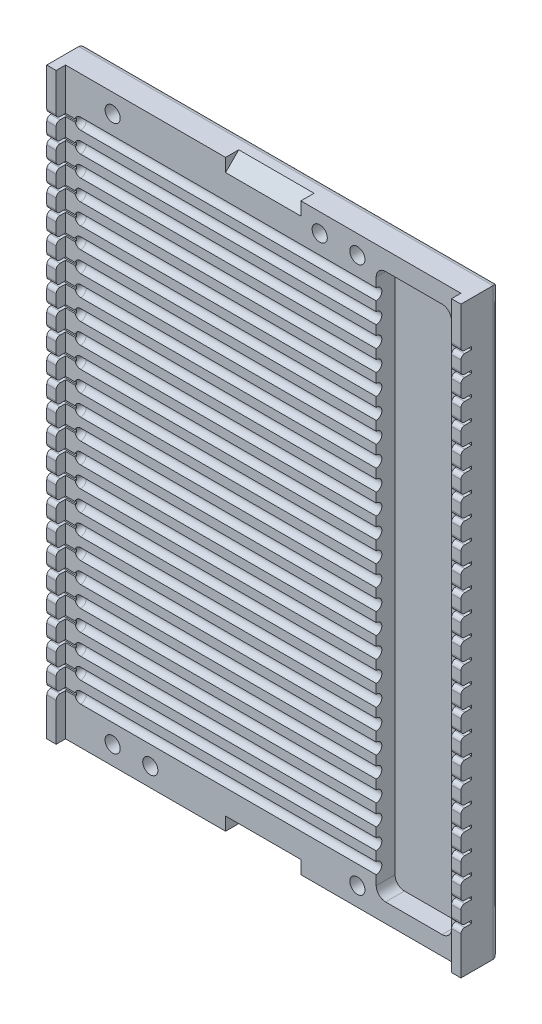
from build123d import *

# Parameters (mm, degrees)
SKETCH_1_W             = 220
SKETCH_1_H             = 310
EXTRUDE_1_DEPTH        = 15
SKETCH_8_W             = 5
SKETCH_8_H             = 310
EXTRUDE_2_DEPTH        = 5
PATTERN_LINEAR_1_COUNT = 25
PATTERN_LINEAR_1_PITCH = 11
SKETCH_4_W             = 40
SKETCH_4_H             = 290
CUT_EXTRUDE_2_DEPTH    = 10
CUT_EXTRUDE_3_DEPTH    = 220
SKETCH_7_R             = 4.025
CUT_EXTRUDE_4_DEPTH    = 191.656759649
FILLET_1_R             = 3
FILLET_2_R             = 5
SKETCH_9_W             = 40
SKETCH_9_H             = 7
CUT_EXTRUDE_6_DEPTH    = 7
CHAMFER_1_SIZE         = 7


# Read off the part's stored shape, not the designer's step: Вырез-Повернуть1
with BuildPart() as part:
    # Эскиз1 → Бобышка-Вытянуть1 (new body)
    with BuildSketch(Plane.XY):
        Rectangle(SKETCH_1_W, SKETCH_1_H)
    extrude(amount=EXTRUDE_1_DEPTH)

    # Эскиз8 → Бобышка-Вытянуть2 (add)
    with BuildSketch(Plane.XY.offset(15)):
        with Locations((-107.5, 0)):
            Rectangle(SKETCH_8_W, SKETCH_8_H)
        with Locations((107.5, 0)):
            Rectangle(SKETCH_8_W, SKETCH_8_H)
    extrude(amount=EXTRUDE_2_DEPTH)

    # Вырез-Повернуть1 outline → Вырез-Повернуть1 (revolve, cut)
    with BuildSketch(Plane(origin=(0, 132, 15), x_dir=(0, 1, 0), z_dir=(0, 0, -1))):
        with BuildLine():
            Line((0, 60), (0, -100))
            ThreePointArc((0, -100), (2.121320344, -99.121320344), (3, -97))
            Line((3, -97), (3, 60))
            Line((3, 60), (0, 60))
        make_face()
    cut_revolve_1 = revolve(axis=Axis((0, 132, 15), (1, 0, 0)), mode=Mode.SUBTRACT)

    # Линейный массив1: Вырез-Повернуть1 ×25
    with Locations(*[(0, -i * PATTERN_LINEAR_1_PITCH, 0) for i in range(1, PATTERN_LINEAR_1_COUNT)]):
        add(cut_revolve_1, mode=Mode.SUBTRACT)

    # Эскиз4 → Вырез-Вытянуть2 (cut)
    with BuildSketch(Plane.XY.offset(15)):
        with Locations((80, 0)):
            Rectangle(SKETCH_4_W, SKETCH_4_H)
    extrude(amount=-CUT_EXTRUDE_2_DEPTH, mode=Mode.SUBTRACT)

    # Эскиз6 → Вырез-Вытянуть3 (cut)
    with BuildSketch(Plane.ZY.offset(110)):
        with BuildLine():
            Line((18, 121.75), (14.3, 121.75))
            Line((14.3, 121.75), (14.3, 120.25))
            Line((14.3, 120.25), (18, 120.25))
            ThreePointArc((18, 120.25), (19.414213562, 119.664213562), (20, 118.25))
            Line((20, 118.25), (20, 123.75))
            ThreePointArc((20, 123.75), (19.414213562, 122.335786438), (18, 121.75))
        make_face()
        with BuildLine():
            Line((18, 132.75), (14.3, 132.75))
            Line((14.3, 132.75), (14.3, 131.25))
            Line((14.3, 131.25), (18, 131.25))
            ThreePointArc((18, 131.25), (19.414213562, 130.664213562), (20, 129.25))
            Line((20, 129.25), (20, 134.75))
            ThreePointArc((20, 134.75), (19.414213562, 133.335786438), (18, 132.75))
        make_face()
        with BuildLine():
            Line((18, 110.75), (14.3, 110.75))
            Line((14.3, 110.75), (14.3, 109.25))
            Line((14.3, 109.25), (18, 109.25))
            ThreePointArc((18, 109.25), (19.414213562, 108.664213562), (20, 107.25))
            Line((20, 107.25), (20, 112.75))
            ThreePointArc((20, 112.75), (19.414213562, 111.335786438), (18, 110.75))
        make_face()
        with BuildLine():
            Line((18, 99.75), (14.3, 99.75))
            Line((14.3, 99.75), (14.3, 98.25))
            Line((14.3, 98.25), (18, 98.25))
            ThreePointArc((18, 98.25), (19.414213562, 97.664213562), (20, 96.25))
            Line((20, 96.25), (20, 101.75))
            ThreePointArc((20, 101.75), (19.414213562, 100.335786438), (18, 99.75))
        make_face()
        with BuildLine():
            Line((18, 88.75), (14.3, 88.75))
            Line((14.3, 88.75), (14.3, 87.25))
            Line((14.3, 87.25), (18, 87.25))
            ThreePointArc((18, 87.25), (19.414213562, 86.664213562), (20, 85.25))
            Line((20, 85.25), (20, 90.75))
            ThreePointArc((20, 90.75), (19.414213562, 89.335786438), (18, 88.75))
        make_face()
        with BuildLine():
            Line((18, 77.75), (14.3, 77.75))
            Line((14.3, 77.75), (14.3, 76.25))
            Line((14.3, 76.25), (18, 76.25))
            ThreePointArc((18, 76.25), (19.414213562, 75.664213562), (20, 74.25))
            Line((20, 74.25), (20, 79.75))
            ThreePointArc((20, 79.75), (19.414213562, 78.335786438), (18, 77.75))
        make_face()
        with BuildLine():
            Line((18, 66.75), (14.3, 66.75))
            Line((14.3, 66.75), (14.3, 65.25))
            Line((14.3, 65.25), (18, 65.25))
            ThreePointArc((18, 65.25), (19.414213562, 64.664213562), (20, 63.25))
            Line((20, 63.25), (20, 68.75))
            ThreePointArc((20, 68.75), (19.414213562, 67.335786438), (18, 66.75))
        make_face()
        with BuildLine():
            Line((18, 55.75), (14.3, 55.75))
            Line((14.3, 55.75), (14.3, 54.25))
            Line((14.3, 54.25), (18, 54.25))
            ThreePointArc((18, 54.25), (19.414213562, 53.664213562), (20, 52.25))
            Line((20, 52.25), (20, 57.75))
            ThreePointArc((20, 57.75), (19.414213562, 56.335786438), (18, 55.75))
        make_face()
        with BuildLine():
            Line((18, 44.75), (14.3, 44.75))
            Line((14.3, 44.75), (14.3, 43.25))
            Line((14.3, 43.25), (18, 43.25))
            ThreePointArc((18, 43.25), (19.414213562, 42.664213562), (20, 41.25))
            Line((20, 41.25), (20, 46.75))
            ThreePointArc((20, 46.75), (19.414213562, 45.335786438), (18, 44.75))
        make_face()
        with BuildLine():
            Line((18, 33.75), (14.3, 33.75))
            Line((14.3, 33.75), (14.3, 32.25))
            Line((14.3, 32.25), (18, 32.25))
            ThreePointArc((18, 32.25), (19.414213562, 31.664213562), (20, 30.25))
            Line((20, 30.25), (20, 35.75))
            ThreePointArc((20, 35.75), (19.414213562, 34.335786438), (18, 33.75))
        make_face()
        with BuildLine():
            Line((18, 22.75), (14.3, 22.75))
            Line((14.3, 22.75), (14.3, 21.25))
            Line((14.3, 21.25), (18, 21.25))
            ThreePointArc((18, 21.25), (19.414213562, 20.664213562), (20, 19.25))
            Line((20, 19.25), (20, 24.75))
            ThreePointArc((20, 24.75), (19.414213562, 23.335786438), (18, 22.75))
        make_face()
        with BuildLine():
            Line((18, 11.75), (14.3, 11.75))
            Line((14.3, 11.75), (14.3, 10.25))
            Line((14.3, 10.25), (18, 10.25))
            ThreePointArc((18, 10.25), (19.414213562, 9.664213562), (20, 8.25))
            Line((20, 8.25), (20, 13.75))
            ThreePointArc((20, 13.75), (19.414213562, 12.335786438), (18, 11.75))
        make_face()
        with BuildLine():
            Line((18, 0.75), (14.3, 0.75))
            Line((14.3, 0.75), (14.3, -0.75))
            Line((14.3, -0.75), (18, -0.75))
            ThreePointArc((18, -0.75), (19.414213562, -1.335786438), (20, -2.75))
            Line((20, -2.75), (20, 2.75))
            ThreePointArc((20, 2.75), (19.414213562, 1.335786438), (18, 0.75))
        make_face()
        with BuildLine():
            Line((18, -10.25), (14.3, -10.25))
            Line((14.3, -10.25), (14.3, -11.75))
            Line((14.3, -11.75), (18, -11.75))
            ThreePointArc((18, -11.75), (19.414213562, -12.335786438), (20, -13.75))
            Line((20, -13.75), (20, -8.25))
            ThreePointArc((20, -8.25), (19.414213562, -9.664213562), (18, -10.25))
        make_face()
        with BuildLine():
            Line((18, -21.25), (14.3, -21.25))
            Line((14.3, -21.25), (14.3, -22.75))
            Line((14.3, -22.75), (18, -22.75))
            ThreePointArc((18, -22.75), (19.414213562, -23.335786438), (20, -24.75))
            Line((20, -24.75), (20, -19.25))
            ThreePointArc((20, -19.25), (19.414213562, -20.664213562), (18, -21.25))
        make_face()
        with BuildLine():
            Line((18, -32.25), (14.3, -32.25))
            Line((14.3, -32.25), (14.3, -33.75))
            Line((14.3, -33.75), (18, -33.75))
            ThreePointArc((18, -33.75), (19.414213562, -34.335786438), (20, -35.75))
            Line((20, -35.75), (20, -30.25))
            ThreePointArc((20, -30.25), (19.414213562, -31.664213562), (18, -32.25))
        make_face()
        with BuildLine():
            Line((18, -43.25), (14.3, -43.25))
            Line((14.3, -43.25), (14.3, -44.75))
            Line((14.3, -44.75), (18, -44.75))
            ThreePointArc((18, -44.75), (19.414213562, -45.335786438), (20, -46.75))
            Line((20, -46.75), (20, -41.25))
            ThreePointArc((20, -41.25), (19.414213562, -42.664213562), (18, -43.25))
        make_face()
        with BuildLine():
            Line((18, -54.25), (14.3, -54.25))
            Line((14.3, -54.25), (14.3, -55.75))
            Line((14.3, -55.75), (18, -55.75))
            ThreePointArc((18, -55.75), (19.414213562, -56.335786438), (20, -57.75))
            Line((20, -57.75), (20, -52.25))
            ThreePointArc((20, -52.25), (19.414213562, -53.664213562), (18, -54.25))
        make_face()
        with BuildLine():
            Line((18, -65.25), (14.3, -65.25))
            Line((14.3, -65.25), (14.3, -66.75))
            Line((14.3, -66.75), (18, -66.75))
            ThreePointArc((18, -66.75), (19.414213562, -67.335786438), (20, -68.75))
            Line((20, -68.75), (20, -63.25))
            ThreePointArc((20, -63.25), (19.414213562, -64.664213562), (18, -65.25))
        make_face()
        with BuildLine():
            Line((18, -76.25), (14.3, -76.25))
            Line((14.3, -76.25), (14.3, -77.75))
            Line((14.3, -77.75), (18, -77.75))
            ThreePointArc((18, -77.75), (19.414213562, -78.335786438), (20, -79.75))
            Line((20, -79.75), (20, -74.25))
            ThreePointArc((20, -74.25), (19.414213562, -75.664213562), (18, -76.25))
        make_face()
        with BuildLine():
            Line((18, -87.25), (14.3, -87.25))
            Line((14.3, -87.25), (14.3, -88.75))
            Line((14.3, -88.75), (18, -88.75))
            ThreePointArc((18, -88.75), (19.414213562, -89.335786438), (20, -90.75))
            Line((20, -90.75), (20, -85.25))
            ThreePointArc((20, -85.25), (19.414213562, -86.664213562), (18, -87.25))
        make_face()
        with BuildLine():
            Line((18, -98.25), (14.3, -98.25))
            Line((14.3, -98.25), (14.3, -99.75))
            Line((14.3, -99.75), (18, -99.75))
            ThreePointArc((18, -99.75), (19.414213562, -100.335786438), (20, -101.75))
            Line((20, -101.75), (20, -96.25))
            ThreePointArc((20, -96.25), (19.414213562, -97.664213562), (18, -98.25))
        make_face()
        with BuildLine():
            Line((18, -109.25), (14.3, -109.25))
            Line((14.3, -109.25), (14.3, -110.75))
            Line((14.3, -110.75), (18, -110.75))
            ThreePointArc((18, -110.75), (19.414213562, -111.335786438), (20, -112.75))
            Line((20, -112.75), (20, -107.25))
            ThreePointArc((20, -107.25), (19.414213562, -108.664213562), (18, -109.25))
        make_face()
        with BuildLine():
            Line((18, -120.25), (14.3, -120.25))
            Line((14.3, -120.25), (14.3, -121.75))
            Line((14.3, -121.75), (18, -121.75))
            ThreePointArc((18, -121.75), (19.414213562, -122.335786438), (20, -123.75))
            Line((20, -123.75), (20, -118.25))
            ThreePointArc((20, -118.25), (19.414213562, -119.664213562), (18, -120.25))
        make_face()
        with BuildLine():
            Line((18, -131.25), (14.3, -131.25))
            Line((14.3, -131.25), (14.3, -132.75))
            Line((14.3, -132.75), (18, -132.75))
            ThreePointArc((18, -132.75), (19.414213562, -133.335786438), (20, -134.75))
            Line((20, -134.75), (20, -129.25))
            ThreePointArc((20, -129.25), (19.414213562, -130.664213562), (18, -131.25))
        make_face()
    extrude(amount=-CUT_EXTRUDE_3_DEPTH, mode=Mode.SUBTRACT)

    # Эскиз7 → Вырез-Вытянуть4 (cut, through all)
    with BuildSketch(Plane.XY.offset(15)):
        with Locations((-80, 145)):
            Circle(SKETCH_7_R)
        with Locations((50, 145)):
            Circle(SKETCH_7_R)
        with Locations((30, 145)):
            Circle(SKETCH_7_R)
        with Locations((-80, -145)):
            Circle(SKETCH_7_R)
        with Locations((-60, -145)):
            Circle(SKETCH_7_R)
        with Locations((50, -145)):
            Circle(SKETCH_7_R)
    extrude(amount=-CUT_EXTRUDE_4_DEPTH, mode=Mode.SUBTRACT)

    # Скругление1
    fillet_1_edges = [part.edges().sort_by_distance(p)[0] for p in [
        (0, -155, 0),
        (-110, 0, 0),
        (0, 155, 0),
        (110, 0, 0),
    ]]
    fillet(fillet_1_edges, radius=FILLET_1_R)

    # Скругление2
    fillet_2_edges = [part.edges().sort_by_distance(p)[0] for p in [
        (100, 145, 10),
        (100, -145, 10),
        (60, -145, 10),
        (60, 145, 10),
    ]]
    fillet(fillet_2_edges, radius=FILLET_2_R)

    # Эскиз9 → Вырез-Вытянуть6 (cut)
    with BuildSketch(Plane.XY.offset(15)):
        with Locations((0, 151.5)):
            Rectangle(SKETCH_9_W, SKETCH_9_H)
        with Locations((0, -151.5)):
            Rectangle(SKETCH_9_W, SKETCH_9_H)
    extrude(amount=-CUT_EXTRUDE_6_DEPTH, mode=Mode.SUBTRACT)

    # Фаска1
    chamfer_1_edges = [part.edges().sort_by_distance(p)[0] for p in [
        (0, 148, 8),
        (0, -148, 8),
    ]]
    chamfer(chamfer_1_edges, length=CHAMFER_1_SIZE - 0.0001)  # a hair under: the kernel refuses the full size


solid = part.part
